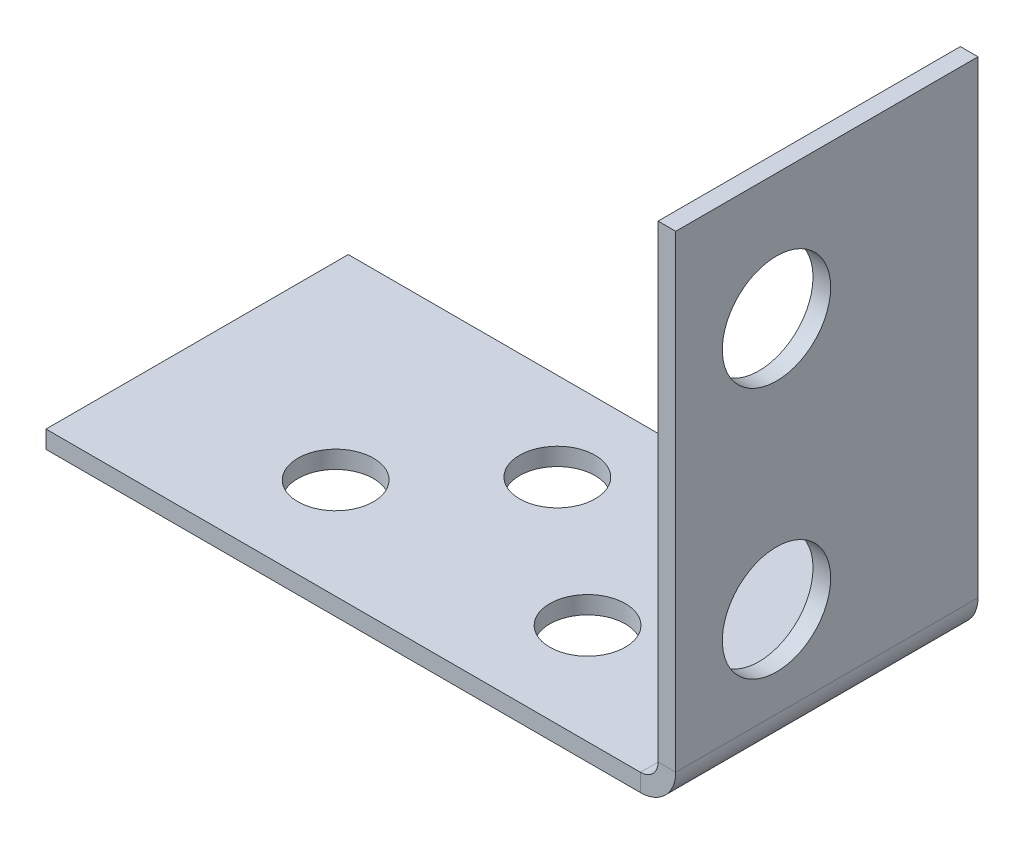
from build123d import *

# Parameters (mm, degrees)
BASE_FLANGE1_DEPTH = 12
SKETCH6_R          = 1.5
CUT_EXTRUDE1_DEPTH = 0.7
SKETCH7_R          = 2.15
CUT_EXTRUDE2_DEPTH = 0.7


# Sheet-metal steps are written as plain solids
with BuildPart() as part:
    # Sketch1 → Base-Flange1 (new body)
    with BuildSketch(Plane.XY):
        with BuildLine():
            Line((0, 0), (23.6, 0))
            ThreePointArc((23.6, 0), (24.589949494, 0.410050506), (25, 1.4))
            Line((25, 1.4), (25, 20))
            Line((25, 20), (24.3, 20))
            Line((24.3, 20), (24.3, 1.4))
            ThreePointArc((24.3, 1.4), (24.094974747, 0.905025253), (23.6, 0.7))
            Line((23.6, 0.7), (0, 0.7))
            Line((0, 0.7), (0, 0))
        make_face()
    extrude(amount=BASE_FLANGE1_DEPTH)

    # Sketch6 → Cut-Extrude1 (cut)
    with BuildSketch(Plane(origin=(0, 0.7, 0), x_dir=(1, 0, 0), z_dir=(0, 1, 0))):
        with Locations(Location((7.5, -8, 0), (0, 0, 270))):
            Circle(SKETCH6_R)
        with Locations(Location((17.5, -8, 0), (0, 0, 270))):
            Circle(SKETCH6_R)
        with Locations(Location((11.8, -3.5, 0), (0, 0, 270))):
            Circle(SKETCH6_R)
    extrude(amount=-CUT_EXTRUDE1_DEPTH, mode=Mode.SUBTRACT)

    # Sketch7 → Cut-Extrude2 (cut)
    with BuildSketch(Plane(origin=(25, 0, 0), x_dir=(0, 0, -1), z_dir=(1, 0, 0))):
        with Locations((-8, 15)):
            Circle(SKETCH7_R)
        with Locations((-8, 5)):
            Circle(SKETCH7_R)
    extrude(amount=-CUT_EXTRUDE2_DEPTH, mode=Mode.SUBTRACT)


solid = part.part
